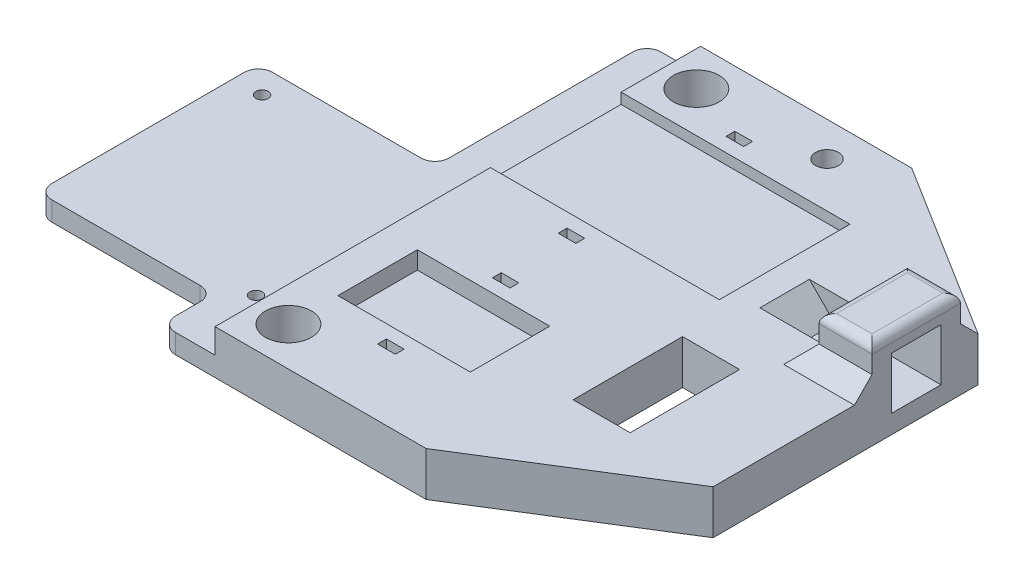
from build123d import *

# Parameters (mm, degrees)
SKETCH1_R               = 1.651
SKETCH1_R_2             = 3.302
SKETCH1_R_3             = 0.889
SKETCH1_W               = 8.2042
SKETCH1_H               = 15.748
BOSS_EXTRUDE1_DEPTH     = 6.35
SKETCH2_W               = 19.05
SKETCH2_H               = 11.43
CUT_EXTRUDE1_DEPTH      = 2.54
CUT_EXTRUDE2_DEPTH      = 83.161835082
CUT_EXTRUDE2_DEPTH_BACK = 83.161835082
SKETCH5_W               = 2.54
SKETCH5_H               = 1.27
SKETCH6_W               = 2.54
SKETCH6_H               = 15.24
CUT_EXTRUDE3_DEPTH      = 1.016
SKETCH7_W               = 40.64
SKETCH7_H               = 18.796
CUT_EXTRUDE4_DEPTH      = 1.524
CUT_EXTRUDE5_DEPTH      = 83.161835082
CUT_EXTRUDE5_DEPTH_BACK = 83.161835082
SKETCH8_W               = 2.54
SKETCH8_H               = 1.27
SKETCH10_W              = 2.54
SKETCH10_H              = 22.86
CUT_EXTRUDE6_DEPTH      = 1.016
SKETCH11_W              = 7.62
SKETCH11_H              = 12.7
BOSS_EXTRUDE2_DEPTH     = 6.35
SKETCH13_W              = 7.112
SKETCH13_H              = 7.493
CUT_EXTRUDE7_DEPTH      = 19.05
CHAMFER3_SIZE           = 2.54
FILLET1_R               = 1.27
CHAMFER4_SIZE           = 3.81
SKETCH14_W              = 33.125812981
SKETCH14_H              = 69.85
CUT_EXTRUDE8_DEPTH      = 3.556
FILLET2_R               = 2.032
CUT_EXTRUDE9_DEPTH      = 1.27


with BuildPart() as part:
    # Sketch1 → Boss-Extrude1 (new body)
    with BuildSketch(Plane(origin=(0, 0, 0), x_dir=(1, 0, 0), z_dir=(0, 1, 0))):
        Polygon((25.4, 64.262), (-12.7, 64.262), (-12.7, 33.782), (-38.1, 33.782), (-38.1, 2.032), (-12.7, 2.032), (-12.7, -5.588), (25.4, -5.588), (50.8, 10.287), (50.8, 48.387), align=None)
        with Locations(Location((18.161, 59.309, 0), (0, 0, 270))):
            Circle(SKETCH1_R, mode=Mode.SUBTRACT)
        with Locations(Location((0, 0, 0), (0, 0, 270))):
            Circle(SKETCH1_R_2, mode=Mode.SUBTRACT)
        with Locations(Location((-9.47933438, 4.811158086, 0), (0, 0, 270))):
            Circle(SKETCH1_R_3, mode=Mode.SUBTRACT)
        with Locations(Location((0, 58.674, 0), (0, 0, 270))):
            Circle(SKETCH1_R_2, mode=Mode.SUBTRACT)
        with Locations((33.9979, 18.923)):
            Rectangle(SKETCH1_W, SKETCH1_H, mode=Mode.SUBTRACT)
        with Locations(Location((-34.005247297, 30.20787503, 0), (0, 0, 270))):
            Circle(SKETCH1_R_3, mode=Mode.SUBTRACT)
    extrude(amount=BOSS_EXTRUDE1_DEPTH)

    # Sketch2 → Cut-Extrude1 (cut)
    with BuildSketch(Plane(origin=(0, 6.35, 0), x_dir=(1, 0, 0), z_dir=(0, 1, 0))):
        with Locations((9.525, 12.827)):
            Rectangle(SKETCH2_W, SKETCH2_H)
    extrude(amount=-CUT_EXTRUDE1_DEPTH, mode=Mode.SUBTRACT)

    # Sketch5 → Cut-Extrude2 (cut, two sides: drawn at the far end of the back side and taken through both)
    with BuildSketch(Plane(origin=(0, 6.35, 0), x_dir=(1, 0, 0), z_dir=(0, 1, 0)).offset(-CUT_EXTRUDE2_DEPTH_BACK)):
        with Locations((10.16, 21.082)):
            Rectangle(SKETCH5_W, SKETCH5_H)
        with Locations((10.16, 4.572)):
            Rectangle(SKETCH5_W, SKETCH5_H)
    extrude(amount=CUT_EXTRUDE2_DEPTH + CUT_EXTRUDE2_DEPTH_BACK, mode=Mode.SUBTRACT)

    # Sketch6 → Cut-Extrude3 (cut)
    with BuildSketch(Plane.XZ):
        with Locations((10.16, -12.827)):
            Rectangle(SKETCH6_W, SKETCH6_H)
    extrude(amount=-CUT_EXTRUDE3_DEPTH, mode=Mode.SUBTRACT)

    # Sketch7 → Cut-Extrude4 (cut)
    with BuildSketch(Plane(origin=(0, 6.35, 0), x_dir=(1, 0, 0), z_dir=(0, 1, 0))):
        with Locations((7.62, 43.434)):
            Rectangle(SKETCH7_W, SKETCH7_H)
    extrude(amount=-CUT_EXTRUDE4_DEPTH, mode=Mode.SUBTRACT)

    # Sketch8 → Cut-Extrude5 (cut, two sides: drawn at the far end of the back side and taken through both)
    with BuildSketch(Plane(origin=(0, 6.35, 0), x_dir=(1, 0, 0), z_dir=(0, 1, 0)).offset(-CUT_EXTRUDE5_DEPTH_BACK)):
        with Locations((9.344785272, 55.499)):
            Rectangle(SKETCH8_W, SKETCH8_H)
        with Locations((9.344785272, 31.369)):
            Rectangle(SKETCH8_W, SKETCH8_H)
    extrude(amount=CUT_EXTRUDE5_DEPTH + CUT_EXTRUDE5_DEPTH_BACK, mode=Mode.SUBTRACT)

    # Sketch10 → Cut-Extrude6 (cut)
    with BuildSketch(Plane.XZ):
        with Locations((9.344785272, -43.434)):
            Rectangle(SKETCH10_W, SKETCH10_H)
    extrude(amount=-CUT_EXTRUDE6_DEPTH, mode=Mode.SUBTRACT)

    # Sketch11 → Boss-Extrude2 (add)
    with BuildSketch(Plane(origin=(0, 6.35, 0), x_dir=(1, 0, 0), z_dir=(0, 1, 0))):
        with Locations((46.99, 39.497)):
            Rectangle(SKETCH11_W, SKETCH11_H)
    extrude(amount=BOSS_EXTRUDE2_DEPTH)

    # Sketch13 → Cut-Extrude7 (cut)
    with BuildSketch(Plane(origin=(50.8, 0, 0), x_dir=(0, 0, -1), z_dir=(1, 0, 0))):
        with Locations((39.497, 6.4135)):
            Rectangle(SKETCH13_W, SKETCH13_H)
    extrude(amount=-CUT_EXTRUDE7_DEPTH, mode=Mode.SUBTRACT)

    # Chamfer3
    chamfer3_edges = [part.edges().sort_by_distance(p)[0] for p in [
        (46.99, 6.35, -45.847),
        (43.18, 6.35, -44.45),
        (46.99, 6.35, -33.147),
        (43.18, 6.35, -34.544),
    ]]
    chamfer(chamfer3_edges, length=CHAMFER3_SIZE)

    # Fillet1
    fillet1_edges = [part.edges().sort_by_distance(p)[0] for p in [
        (50.8, 12.7, -39.497),
        (46.99, 12.7, -45.847),
        (43.18, 12.7, -39.497),
        (46.99, 12.7, -33.147),
    ]]
    fillet(fillet1_edges, radius=FILLET1_R)

    # Chamfer4
    # the kernel refuses this chamfer: 3.81 mm, written as the material it adds along each edge
    with BuildSketch(Plane(origin=(31.75, 2.667, -52.851112184), x_dir=(0.9996219169112968, -0.027495876610586386, 0), z_dir=(0, 0, 1))) as chamfer4_piece_1_section:
        Polygon((CHAMFER4_SIZE * 0.999621916911, CHAMFER4_SIZE * 0.0274958766106), (-CHAMFER4_SIZE * 0.0274958766106, CHAMFER4_SIZE * 0.999621916911), (0, 0), align=None)
    chamfer4_piece_1 = extrude(amount=26.708224368, mode=Mode.PRIVATE)
    chamfer4_piece_1 = split(chamfer4_piece_1, bisect_by=Plane(origin=(33.021365591, 6.35, -39.497), z_dir=(0, -1, 0)), keep=Keep.TOP, mode=Mode.PRIVATE)
    chamfer4_piece_1 = split(chamfer4_piece_1, bisect_by=Plane(origin=(33.021365591, 3.934268817, -26.797), z_dir=(0, 0, -1)), keep=Keep.TOP, mode=Mode.PRIVATE)
    add(chamfer4_piece_1)

    # Sketch14 → Cut-Extrude8 (cut)
    with BuildSketch(Plane(origin=(0, 6.35, 0), x_dir=(1, 0, 0), z_dir=(0, 1, 0))):
        with Locations((-21.53709351, 29.337)):
            Rectangle(SKETCH14_W, SKETCH14_H)
    extrude(amount=-CUT_EXTRUDE8_DEPTH, mode=Mode.SUBTRACT)

    # Fillet2
    fillet2_edges = [part.edges().sort_by_distance(p)[0] for p in [
        (-38.1, 1.397, -33.782),
        (-12.7, 1.397, -33.782),
        (-12.7, 1.397, -2.032),
        (-38.1, 1.397, -2.032),
        (-12.7, 1.397, -64.262),
        (-12.7, 1.397, 5.588),
    ]]
    fillet(fillet2_edges, radius=FILLET2_R)

    # Sketch16 → Cut-Extrude9 (cut)
    with BuildSketch(Plane.XZ):
        Polygon((-10.74933438, -7.010862612), (-8.20933438, -7.010862612), (-6.93933438, -4.811158086), (-8.20933438, -2.61145356), (-10.74933438, -2.61145356), (-12.01933438, -4.811158086), align=None)
        Polygon((-32.74988098, -32.415963663), (-31.465303289, -30.224740225), (-32.720669607, -28.016651592), (-35.260613615, -27.999786398), (-36.545191306, -30.191009836), (-35.289824988, -32.399098469), align=None)
    extrude(amount=-CUT_EXTRUDE9_DEPTH, mode=Mode.SUBTRACT)


solid = part.part
